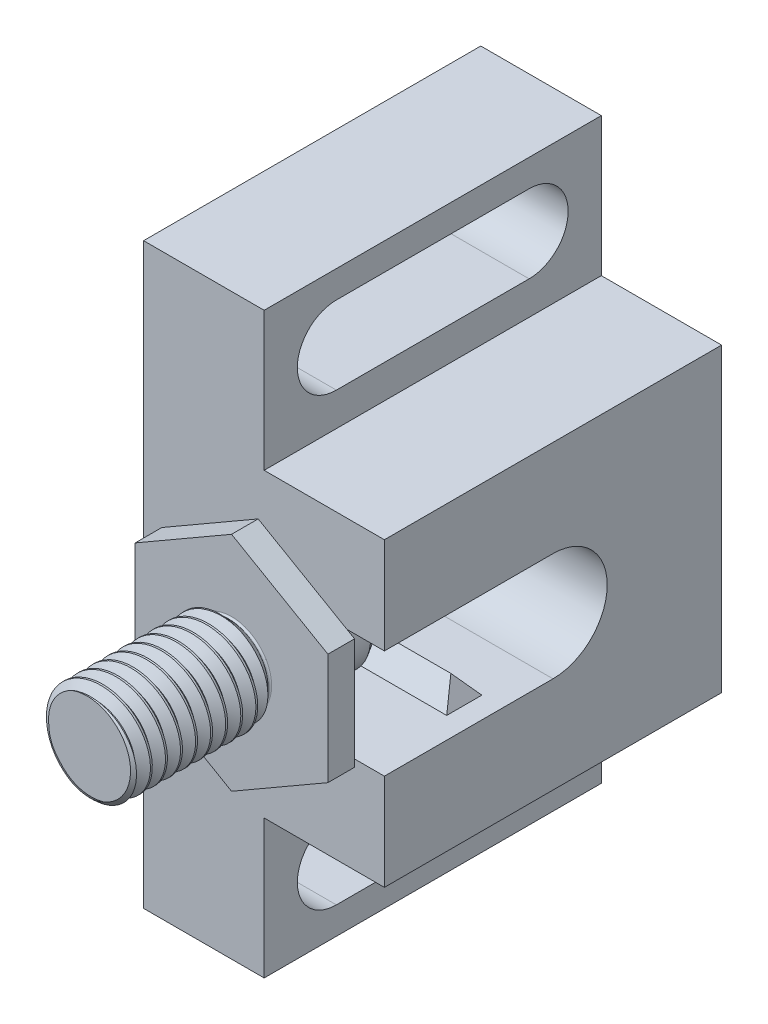
from build123d import *

# Parameters (mm, degrees)
BOSS_EXTRUDE1_DEPTH      = 13.9954
BOSS_EXTRUDE1_DEPTH_BACK = 13.9954
CUT_EXTRUDE1_DEPTH       = 30.532478527
CUT_EXTRUDE2_START       = -13.9954
CUT_EXTRUDE2_DEPTH       = 13.9954
BOSS_EXTRUDE2_REACH      = 36.229
CUT_EXTRUDE3_START       = -9.867621
CUT_EXTRUDE3_DEPTH       = 2.917981
SKETCH11_OUTSIDE_W       = 35.444
SKETCH11_OUTSIDE_H       = 63.46
CUT_EXTRUDE4_DEPTH       = 41.218703731
CUT_SWEEP1_PITCH         = 1.25


with BuildPart() as part:
    # Sketch4 → Boss-Extrude1 (new, two sides: drawn at the far end of the back side and taken through both)
    with BuildSketch(Plane.XY.offset(-BOSS_EXTRUDE1_DEPTH_BACK)):
        Polygon((9.9949, -12.4968), (9.9949, 12.4968), (0.0127, 12.4968), (0.0127, 24.003), (-9.9949, 24.003), (-9.9949, -24.003), (0.0127, -24.003), (0.0127, -12.4968), align=None)
    extrude(amount=BOSS_EXTRUDE1_DEPTH + BOSS_EXTRUDE1_DEPTH_BACK)

    # Sketch5 → Cut-Extrude1 (cut, through all)
    with BuildSketch(Plane(origin=(0.0127, 0, 0), x_dir=(0, 0, -1), z_dir=(1, 0, 0))):
        with BuildLine():
            Line((-8.001, 21.7424), (8.001, 21.7424))
            ThreePointArc((8.001, 21.7424), (11.2395, 18.5039), (8.001, 15.2654))
            Line((8.001, 15.2654), (-8.001, 15.2654))
            ThreePointArc((-8.001, 15.2654), (-11.2395, 18.5039), (-8.001, 21.7424))
        make_face()
        with BuildLine():
            Line((-8.001, -21.7424), (8.001, -21.7424))
            ThreePointArc((8.001, -21.7424), (11.2395, -18.5039), (8.001, -15.2654))
            Line((8.001, -15.2654), (-8.001, -15.2654))
            ThreePointArc((-8.001, -15.2654), (-11.2395, -18.5039), (-8.001, -21.7424))
        make_face()
    extrude(amount=-CUT_EXTRUDE1_DEPTH, mode=Mode.SUBTRACT)

    # Sketch6 → Cut-Revolve1 (revolve, cut)
    with BuildSketch(Plane.XY, mode=Mode.PRIVATE) as cut_revolve1_sk:
        with BuildLine():
            Line((-0.4953, 4.5), (9.9949, 4.5))
            Line((9.9949, 4.5), (9.9949, 0))
            Line((9.9949, 0), (-4.9953, 0))
            ThreePointArc((-4.9953, 0), (-3.677280515, 3.181980515), (-0.4953, 4.5))
        make_face()
    revolve(cut_revolve1_sk.sketch.rotate(Axis((-0.4953, 0, 0), (1, 0, 0)), 180), axis=Axis((-0.4953, 0, 0), (1, 0, 0)), mode=Mode.SUBTRACT)

    # Sketch7 → Cut-Extrude2 (cut)
    with BuildSketch(Plane.XY.offset(13.9954).offset(CUT_EXTRUDE2_START)):
        with BuildLine():
            Line((-0.4953, 4.5), (9.9949, 4.5))
            Line((9.9949, 4.5), (9.9949, -4.5))
            Line((9.9949, -4.5), (-0.4953, -4.5))
            ThreePointArc((-0.4953, -4.5), (-4.9953, 0), (-0.4953, 4.5))
        make_face()
    extrude(amount=CUT_EXTRUDE2_DEPTH, mode=Mode.SUBTRACT)

    # Sketch8 → Boss-Extrude2 (add, up to next)
    with BuildSketch(Plane(origin=(9.9949, 0, 0), x_dir=(0, 0, -1), z_dir=(1, 0, 0)), mode=Mode.PRIVATE) as boss_extrude2_sk1:
        Polygon((-4.1277794, -4.5), (-7.045759848, -4.5), (-5.586769624, -2.761243254), align=None)
    boss_extrude2_tool1 = extrude(boss_extrude2_sk1.sketch, amount=-BOSS_EXTRUDE2_REACH, mode=Mode.PRIVATE) - part.part
    # Sketch8 → Boss-Extrude2 (add, up to next)
    with BuildSketch(Plane(origin=(9.9949, 0, 0), x_dir=(0, 0, -1), z_dir=(1, 0, 0)), mode=Mode.PRIVATE) as boss_extrude2_sk2:
        Polygon((-5.586769624, 2.761243254), (-4.1277794, 4.5), (-7.045759848, 4.5), align=None)
    boss_extrude2_tool2 = extrude(boss_extrude2_sk2.sketch, amount=-BOSS_EXTRUDE2_REACH, mode=Mode.PRIVATE) - part.part
    add(boss_extrude2_tool1.solids().sort_by_distance((9.9949, -3.920414, 5.58677))[0])
    add(boss_extrude2_tool2.solids().sort_by_distance((9.9949, 3.920414, 5.58677))[0])

    # Sketch9 → Cut-Extrude3 (cut)
    with BuildSketch(Plane.XY.offset(13.9954).offset(CUT_EXTRUDE3_START)):
        Polygon((9.9949, 4.5), (9.9949, 2.761243254), (7.105263158, 2.761243254), (8.2169, 4.5), align=None)
        Polygon((8.2169, -4.5), (9.9949, -4.5), (9.9949, -2.761243254), (7.105263158, -2.761243254), align=None)
    extrude(amount=CUT_EXTRUDE3_DEPTH, mode=Mode.SUBTRACT)


with BuildPart() as body_2:
    # Sketch10 → Revolve1 (revolve)
    with BuildSketch(Plane(origin=(0, 0, 0), x_dir=(1, 0, 0), z_dir=(0, 1, 0))):
        with BuildLine():
            Line((0, -28.67730612), (3.603125, -28.67730612))
            Line((3.603125, -28.67730612), (4, -28.28043112))
            Line((4, -28.28043112), (4, -17.668871768))
            Line((4, -17.668871768), (3.236436913, -16.905308681))
            ThreePointArc((3.236436913, -16.905308681), (3.208906773, -16.766905324), (3.326239474, -16.68850612))
            Line((3.326239474, -16.68850612), (9.9949, -16.68850612))
            Line((9.9949, -16.68850612), (9.9949, -14.47870612))
            Line((9.9949, -14.47870612), (4, -14.47870612))
            Line((4, -14.47870612), (4, -9.145270762))
            Line((4, -9.145270762), (1.912155719, -5.529018389))
            ThreePointArc((1.912155719, -5.529018389), (3.345755081, -1.801102228), (0, 0.38029388))
            Line((0, 0.38029388), (0, -28.67730612))
        make_face()
    revolve(axis=Axis((0, 0, 28.67730612), (0, 0, -1)))

    # Sketch11 outside → Cut-Extrude4 (cut, through all)
    with BuildSketch(Plane.XY.offset(16.68850612)):
        Rectangle(SKETCH11_OUTSIDE_W, SKETCH11_OUTSIDE_H)
        Polygon((8, 4.618802154), (0, 9.237604307), (-8, 4.618802154), (-8, -4.618802154), (0, -9.237604307), (8, -4.618802154), align=None, mode=Mode.SUBTRACT)
    extrude(amount=-CUT_EXTRUDE4_DEPTH, mode=Mode.SUBTRACT)

    # Cut-Sweep1: the profile of Sketch13 profile screwed along a right-hand helix of 9.59104 turns, 8 arcs to a turn; built about Z, then put on its axis
    cut_sweep1_z = Axis((0, 0, 0), (0, 0, 1))
    cut_sweep1_corners = [(4.0003, 0, -1.093923205), (3.188101184, 0, -0.625), (3.188101184, 0, -0.46875), (4.0003, 0, 0.000173205)]
    with BuildLine(mode=Mode.PRIVATE) as cut_sweep1_profile:
        Line(cut_sweep1_corners[0], cut_sweep1_corners[1])
        Line(cut_sweep1_corners[1], cut_sweep1_corners[2])
        Line(cut_sweep1_corners[2], cut_sweep1_corners[3])
        Line(cut_sweep1_corners[3], cut_sweep1_corners[0])
    cut_sweep1_cap = Face(cut_sweep1_profile.wire())
    cut_sweep1_turn_angles = [0, 22.5, 45, 67.5, 90, 112.5, 135, 157.5, 180, 202.5, 225, 247.5, 270, 292.5, 315, 337.5, 360]
    cut_sweep1_turn_weights = [1, 0.9238795325112867, 1, 0.9238795325112867, 1, 0.9238795325112867, 1, 0.9238795325112867, 1, 0.9238795325112867, 1, 0.9238795325112867, 1, 0.9238795325112867, 1, 0.9238795325112867, 1]
    cut_sweep1_turn_rails = [Edge.make_bspline([Vector(p[0], p[1], 0).rotate(cut_sweep1_z, cut_sweep1_turn_angles[k]) / cut_sweep1_turn_weights[k] + Vector(0, 0, p[2] + CUT_SWEEP1_PITCH * cut_sweep1_turn_angles[k] / 360) for k in range(17)], [0, 0, 0, 1, 1, 2, 2, 3, 3, 4, 4, 5, 5, 6, 6, 7, 7, 8, 8, 8], 2, cut_sweep1_turn_weights) for p in cut_sweep1_corners]
    cut_sweep1_turn_sides = [Face.make_surface_from_curves(cut_sweep1_turn_rails[p[0]], cut_sweep1_turn_rails[p[1]]) for p in [(0, 1), (1, 2), (2, 3), (3, 0)]]
    cut_sweep1_last_angles = [3240, 3262.5, 3285, 3307.5, 3330, 3352.5, 3375, 3397.5, 3420, 3436.3872, 3452.7744]
    cut_sweep1_last_weights = [1, 0.9238795325112867, 1, 0.9238795325112867, 1, 0.9238795325112867, 1, 0.9238795325112867, 1, 0.9593770262875212, 1]
    cut_sweep1_last_rails = [Edge.make_bspline([Vector(p[0], p[1], 0).rotate(cut_sweep1_z, cut_sweep1_last_angles[k]) / cut_sweep1_last_weights[k] + Vector(0, 0, p[2] + CUT_SWEEP1_PITCH * cut_sweep1_last_angles[k] / 360) for k in range(11)], [0, 0, 0, 1, 1, 2, 2, 3, 3, 4, 4, 5, 5, 5], 2, cut_sweep1_last_weights) for p in cut_sweep1_corners]
    cut_sweep1_last_sides = [Face.make_surface_from_curves(cut_sweep1_last_rails[p[0]], cut_sweep1_last_rails[p[1]]) for p in [(0, 1), (1, 2), (2, 3), (3, 0)]]
    cut_sweep1 = Plane(origin=(0, 0, 28.67730612), x_dir=(1, 0, 0), z_dir=(0, 0, -1)) * Solid(Shell([*[p.moved(Location((0, 0, CUT_SWEEP1_PITCH * i))) for i in range(9) for p in cut_sweep1_turn_sides], *cut_sweep1_last_sides, cut_sweep1_cap, cut_sweep1_cap.rotate(cut_sweep1_z, 3452.7744).moved(Location((0, 0, CUT_SWEEP1_PITCH * 3452.7744 / 360)))]))
    add(cut_sweep1, mode=Mode.SUBTRACT)


solid = Compound([part.part, body_2.part])
